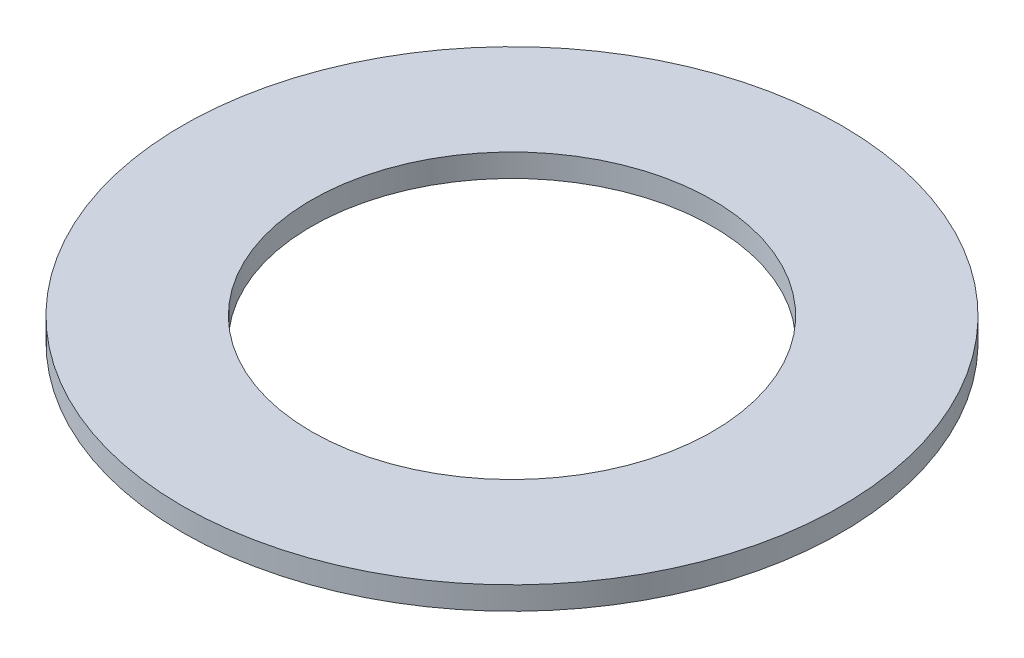
from build123d import *

# Parameters (mm, degrees)
SKETCH1_R           = 57.5
BOSS_EXTRUDE1_DEPTH = 4
SKETCH2_R           = 35
CUT_EXTRUDE1_DEPTH  = 82.415600471


with BuildPart() as part:
    # Sketch1 → Boss-Extrude1 (new body)
    with BuildSketch(Plane(origin=(0, 0, 0), x_dir=(1, 0, 0), z_dir=(0, 1, 0))):
        Circle(SKETCH1_R)
    extrude(amount=BOSS_EXTRUDE1_DEPTH)

    # Sketch2 → Cut-Extrude1 (cut, through all)
    with BuildSketch(Plane(origin=(0, 0, 0), x_dir=(1, 0, 0), z_dir=(0, 1, 0))):
        Circle(SKETCH2_R)
    extrude(amount=CUT_EXTRUDE1_DEPTH, mode=Mode.SUBTRACT)


solid = part.part
